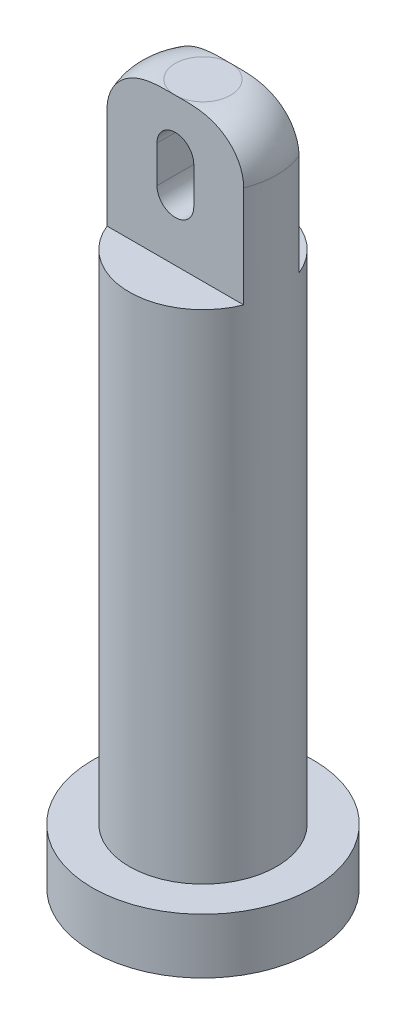
from build123d import *

# Parameters (mm, degrees)
SKETCH1_R           = 3
BOSS_EXTRUDE1_DEPTH = 1.5
SKETCH2_R           = 2
BOSS_EXTRUDE2_DEPTH = 13.5
BOSS_EXTRUDE3_DEPTH = 4
CUT_EXTRUDE1_DEPTH  = 3
FILLET5_R           = 1.25


with BuildPart() as part:
    # Sketch1 → Boss-Extrude1 (new body)
    with BuildSketch(Plane(origin=(0, 0, 0), x_dir=(1, 0, 0), z_dir=(0, 1, 0))):
        with Locations(Location((0, 0, 0), (0, 0, 270))):
            Circle(SKETCH1_R)
    extrude(amount=BOSS_EXTRUDE1_DEPTH)

    # Sketch2 → Boss-Extrude2 (add)
    with BuildSketch(Plane(origin=(0, 1.5, 0), x_dir=(1, 0, 0), z_dir=(0, 1, 0))):
        with Locations(Location((0, 0, 0), (0, 0, 270))):
            Circle(SKETCH2_R)
    extrude(amount=BOSS_EXTRUDE2_DEPTH)

    # Sketch6 → Boss-Extrude3 (add)
    with BuildSketch(Plane(origin=(0, 15, 0), x_dir=(1, 0, 0), z_dir=(0, 1, 0))):
        with BuildLine():
            Line((1.854049622, 0.75), (-1.854049622, 0.75))
            ThreePointArc((-1.854049622, 0.75), (-2, 0), (-1.854049622, -0.75))
            Line((-1.854049622, -0.75), (1.854049622, -0.75))
            ThreePointArc((1.854049622, -0.75), (2, 0), (1.854049622, 0.75))
        make_face()
    extrude(amount=BOSS_EXTRUDE3_DEPTH)

    # Sketch7 → Cut-Extrude1 (cut)
    with BuildSketch(Plane.XY.offset(0.75)):
        with BuildLine():
            Line((-0.5, 16.62671351), (-0.5, 17.62671351))
            ThreePointArc((-0.5, 17.62671351), (0, 18.12671351), (0.5, 17.62671351))
            Line((0.5, 17.62671351), (0.5, 16.62671351))
            ThreePointArc((0.5, 16.62671351), (0, 16.12671351), (-0.5, 16.62671351))
        make_face()
    extrude(amount=-CUT_EXTRUDE1_DEPTH, mode=Mode.SUBTRACT)

    # Fillet5
    fillet5_edges = [part.edges().sort_by_distance(p)[0] for p in [
        (-2, 19, 0),
        (2, 19, 0),
    ]]
    fillet(fillet5_edges, radius=FILLET5_R - 0.0001)  # a hair under: the kernel refuses the full size


solid = part.part
